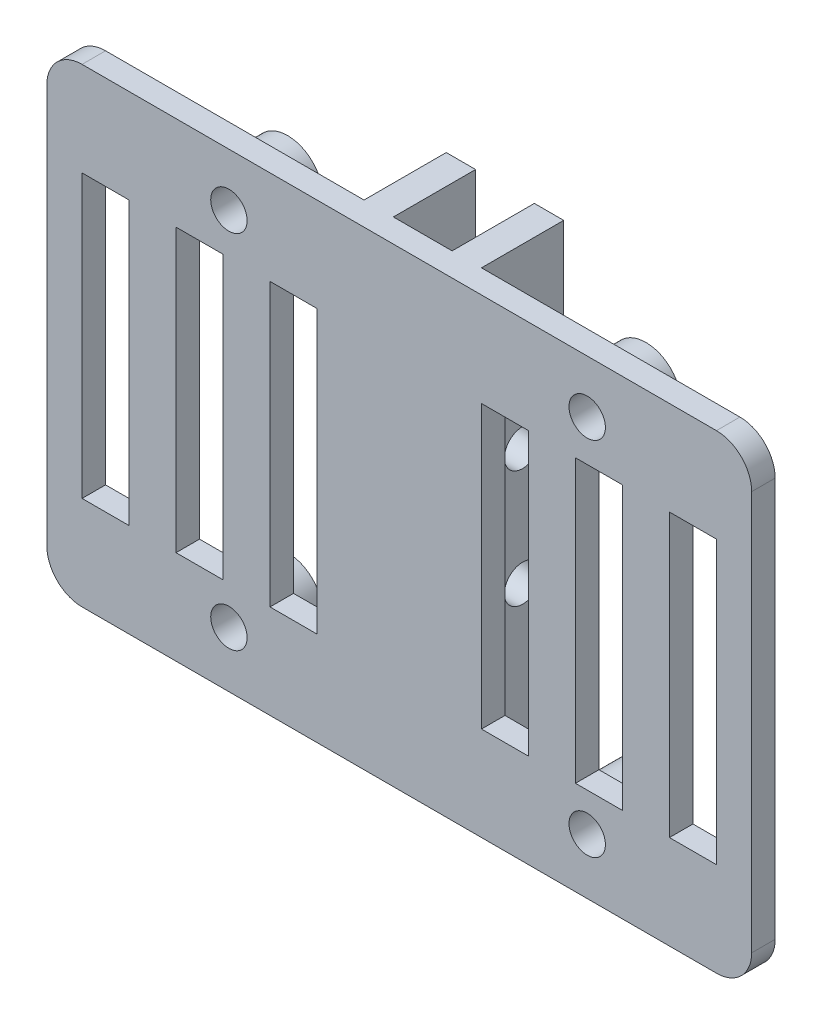
from build123d import *

# Parameters (mm, degrees)
ESQUISSE1_W                  = 60
ESQUISSE1_H                  = 40
BOSS_EXTRU_1_DEPTH           = 9
ESQUISSE2_W                  = 25
ESQUISSE2_H                  = 40
ESQUISSE2_W_2                = 5
ENL_V_MAT_EXTRU_1_DEPTH      = 7
ESQUISSE3_R                  = 1.55
ENL_V_MAT_EXTRU_2_DEPTH      = 54.907327888
CONG_1_R                     = 3
ESQUISSE9_R                  = 3
BOSS_EXTRU_2_DEPTH           = 3
ENL_V_MAT_EXTRU_4_DEPTH      = 73.449982747
ENL_V_MAT_EXTRU_4_DEPTH_BACK = 73.449982747
ESQUISSE5_R                  = 1.55
ESQUISSE8_W                  = 4
ESQUISSE8_H                  = 24
ENL_V_MAT_EXTRU_5_DEPTH      = 7
ESQUISSE6_W                  = 4
ESQUISSE6_H                  = 24
ENL_V_MAT_EXTRU_6_DEPTH      = 7


with BuildPart() as part:
    # Esquisse1 → Boss.-Extru.1 (new body)
    with BuildSketch(Plane.XY):
        with Locations((30, 20)):
            Rectangle(ESQUISSE1_W, ESQUISSE1_H)
    extrude(amount=BOSS_EXTRU_1_DEPTH)

    # Esquisse2 → Enlèv. mat.-Extru.1 (cut)
    with BuildSketch(Plane(origin=(0, 0, 0), x_dir=(-1, 0, 0), z_dir=(0, 0, -1))):
        with Locations((-12.5, 20)):
            Rectangle(ESQUISSE2_W, ESQUISSE2_H)
        with Locations((-47.5, 20)):
            Rectangle(ESQUISSE2_W, ESQUISSE2_H)
        with Locations((-30, 20)):
            Rectangle(ESQUISSE2_W_2, ESQUISSE2_H)
    extrude(amount=-ENL_V_MAT_EXTRU_1_DEPTH, mode=Mode.SUBTRACT)

    # Esquisse3 → Enlèv. mat.-Extru.2 (cut, through all)
    with BuildSketch(Plane(origin=(35, 0, 0), x_dir=(0, 0, -1), z_dir=(1, 0, 0))):
        with Locations((-3.5, 15)):
            Circle(ESQUISSE3_R)
        with Locations((-3.5, 25)):
            Circle(ESQUISSE3_R)
    extrude(amount=-ENL_V_MAT_EXTRU_2_DEPTH, mode=Mode.SUBTRACT)

    # Congé1
    cong_1_edges = [part.edges().sort_by_distance(p)[0] for p in [
        (0, 0, 8),
        (60, 0, 8),
        (0, 40, 8),
        (60, 40, 8),
    ]]
    fillet(cong_1_edges, radius=CONG_1_R)

    # Esquisse9 → Boss.-Extru.2 (add)
    with BuildSketch(Plane(origin=(0, 0, 7), x_dir=(-1, 0, 0), z_dir=(0, 0, -1))):
        with Locations((-46, 35.5)):
            Circle(ESQUISSE9_R)
        with Locations((-15.5, 35.5)):
            Circle(ESQUISSE9_R)
        with Locations((-15.5, 4.75)):
            Circle(ESQUISSE9_R)
        with Locations((-46, 4.75)):
            Circle(ESQUISSE9_R)
    extrude(amount=BOSS_EXTRU_2_DEPTH)

    # Esquisse5 → Enlèv. mat.-Extru.4 (cut, two sides: drawn at the far end of the back side and taken through both)
    with BuildSketch(Plane(origin=(0, 0, 7), x_dir=(-1, 0, 0), z_dir=(0, 0, -1)).offset(-ENL_V_MAT_EXTRU_4_DEPTH_BACK)):
        with Locations((-46, 35.5)):
            Circle(ESQUISSE5_R)
        with Locations((-46, 4.75)):
            Circle(ESQUISSE5_R)
        with Locations((-15.5, 4.75)):
            Circle(ESQUISSE5_R)
        with Locations((-15.5, 35.5)):
            Circle(ESQUISSE5_R)
    extrude(amount=ENL_V_MAT_EXTRU_4_DEPTH + ENL_V_MAT_EXTRU_4_DEPTH_BACK, mode=Mode.SUBTRACT)

    # Esquisse8 → Enlèv. mat.-Extru.5 (cut)
    with BuildSketch(Plane(origin=(0, 0, 7), x_dir=(-1, 0, 0), z_dir=(0, 0, -1))):
        with Locations((-13, 20)):
            Rectangle(ESQUISSE8_W, ESQUISSE8_H)
        with Locations((-5, 20)):
            Rectangle(ESQUISSE8_W, ESQUISSE8_H)
        with Locations((-21, 20)):
            Rectangle(ESQUISSE8_W, ESQUISSE8_H)
    extrude(amount=-ENL_V_MAT_EXTRU_5_DEPTH, mode=Mode.SUBTRACT)

    # Esquisse6 → Enlèv. mat.-Extru.6 (cut)
    with BuildSketch(Plane(origin=(0, 0, 7), x_dir=(-1, 0, 0), z_dir=(0, 0, -1))):
        with Locations((-47, 20)):
            Rectangle(ESQUISSE6_W, ESQUISSE6_H)
        with Locations((-55, 20)):
            Rectangle(ESQUISSE6_W, ESQUISSE6_H)
        with Locations((-39, 20)):
            Rectangle(ESQUISSE6_W, ESQUISSE6_H)
    extrude(amount=-ENL_V_MAT_EXTRU_6_DEPTH, mode=Mode.SUBTRACT)


solid = part.part
